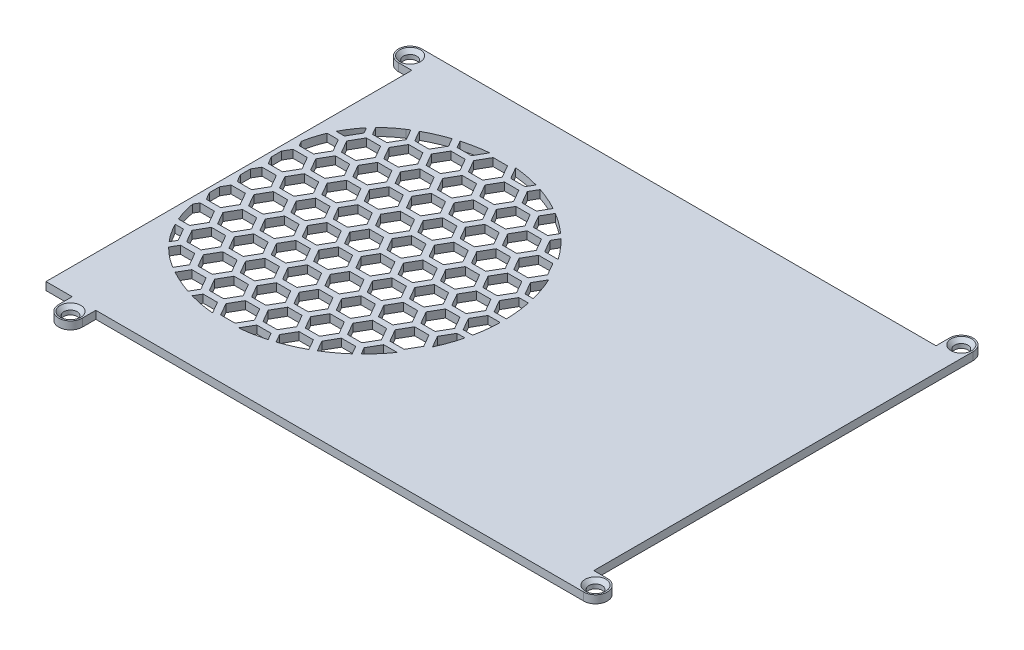
from build123d import *

# Parameters (mm, degrees)
BOSS_EXTRUDE1_DEPTH            = 2.54
CUT_EXTRUDE1_REACH             = 122.398
FILL_START                     = -2.54
FILL_PATTERN1_DEPTH            = 2.54
SKETCH8_W                      = 169.280324126
SKETCH8_H                      = 125.372999712
BOSS_EXTRUDE2_DEPTH            = 2.54
F_6_CLEARANCE_HOLE1_AT_2_COUNT = 2
F_6_CLEARANCE_HOLE1_AT_2_PITCH = 170.02707605
F_6_CLEARANCE_HOLE1_AT_3_COUNT = 2
F_6_CLEARANCE_HOLE1_AT_3_PITCH = 203.837142656
F_6_CLEARANCE_HOLE1_AT_4_COUNT = 2
F_6_CLEARANCE_HOLE1_AT_4_PITCH = 126.560334129


# Read off the part's stored shape, not the designer's step: Fill Pattern1
with BuildPart() as part:
    # Sketch1 → Boss-Extrude1 (new body)
    with BuildSketch(Plane(origin=(0, 0, 0), x_dir=(1, 0, 0), z_dir=(0, 1, 0))):
        with BuildLine():
            Line((-93.360827885, 62.872999984), (72.659829659, 62.872999984))
            Line((72.659829659, 62.872999984), (72.659829659, 67.233333402))
            ThreePointArc((72.659829659, 67.233333402), (76.469829659, 71.043333402), (80.279829659, 67.233333402))
            Line((80.279829659, 67.233333402), (80.279829659, -55.252999984))
            Line((80.279829659, -55.252999984), (84.640163077, -55.252999984))
            ThreePointArc((84.640163077, -55.252999984), (88.450163077, -59.062999984), (84.640163077, -62.872999984))
            Line((84.640163077, -62.872999984), (-72.913826361, -62.872999984))
            Line((-72.913826361, -62.872999984), (-72.913826361, -67.233333402))
            ThreePointArc((-72.913826361, -67.233333402), (-76.723826361, -71.043333402), (-80.533826361, -67.233333402))
            Line((-80.533826361, -67.233333402), (-80.533826361, -62.872999984))
            Line((-80.533826361, -62.872999984), (-89.000494467, -62.872999984))
            Line((-89.000494467, -62.872999984), (-89.000494467, 55.252999984))
            Line((-89.000494467, 55.252999984), (-93.360827885, 55.252999984))
            ThreePointArc((-93.360827885, 55.252999984), (-97.170827885, 59.062999984), (-93.360827885, 62.872999984))
        make_face()
    extrude(amount=-BOSS_EXTRUDE1_DEPTH)

    # Sketch7 → Cut-Extrude1 (cut, up to next)
    with BuildSketch(Plane(origin=(0, 0, 0), x_dir=(1, 0, 0), z_dir=(0, 1, 0)), mode=Mode.PRIVATE) as cut_extrude1_sk1:
        Polygon((-44.541691973, 0), (-46.85109305, 4.000000001), (-51.469895205, 4.000000001), (-53.779296282, 0), (-51.469895205, -4.000000001), (-46.85109305, -4.000000001), align=None)
    cut_extrude1_tool1 = extrude(cut_extrude1_sk1.sketch, amount=-CUT_EXTRUDE1_REACH, mode=Mode.PRIVATE) & part.part
    add(cut_extrude1_tool1.solids().sort_by_distance((-49.160494, 0, 0))[0], mode=Mode.SUBTRACT)

    # Fill Pattern1 outline → Fill Pattern1 (cut)
    with BuildSketch(Plane(origin=(0, 0, 0), x_dir=(1, 0, 0), z_dir=(0, 1, 0)).offset(FILL_START)):
        Polygon((-34.149387015, 26.000000197), (-29.53058486, 26.000000197), (-27.221183783, 30.000000198), (-29.53058486, 34.000000199), (-34.149387015, 34.000000199), (-36.458788092, 30.000000198), align=None)
        Polygon((-60.1301493, -19.0000001), (-55.511347145, -19.0000001), (-53.201946068, -15.000000099), (-55.511347145, -11.000000098), (-60.1301493, -11.000000098), (-62.439550377, -15.000000099), align=None)
        Polygon((-68.790403395, -34.000000199), (-64.17160124, -34.000000199), (-61.862200163, -30.000000198), (-64.17160124, -26.000000197), (-68.790403395, -26.000000197), (-71.099804472, -30.000000198), align=None)
        Polygon((-42.80964111, 11.000000098), (-38.190838955, 11.000000098), (-35.881437878, 15.000000099), (-38.190838955, 19.0000001), (-42.80964111, 19.0000001), (-45.119042187, 15.000000099), align=None)
        Polygon((-88.420312662, 0), (-86.110911585, -4.000000001), (-81.49210943, -4.000000001), (-79.182708353, 0), (-81.49210943, 4.000000001), (-86.110911585, 4.000000001), align=None)
        Polygon((-71.099804472, 0), (-68.790403395, -4.000000001), (-64.17160124, -4.000000001), (-61.862200163, 0), (-64.17160124, 4.000000001), (-68.790403395, 4.000000001), align=None)
        Polygon((-19.138279902, 0), (-16.828878825, -4.000000001), (-12.21007667, -4.000000001), (-9.900675593, 0), (-12.21007667, 4.000000001), (-16.828878825, 4.000000001), align=None)
        Polygon((-36.458788092, 0), (-34.149387015, -4.000000001), (-29.53058486, -4.000000001), (-27.221183783, 0), (-29.53058486, 4.000000001), (-34.149387015, 4.000000001), align=None)
        Polygon((-34.149387015, -26.000000197), (-36.458788092, -30.000000198), (-34.149387015, -34.000000199), (-29.53058486, -34.000000199), (-27.221183783, -30.000000198), (-29.53058486, -26.000000197), align=None)
        Polygon((-42.80964111, -11.000000098), (-45.119042187, -15.000000099), (-42.80964111, -19.0000001), (-38.190838955, -19.0000001), (-35.881437878, -15.000000099), (-38.190838955, -11.000000098), align=None)
        Polygon((-68.790403395, 34.000000199), (-71.099804472, 30.000000198), (-68.790403395, 26.000000197), (-64.17160124, 26.000000197), (-61.862200163, 30.000000198), (-64.17160124, 34.000000199), align=None)
        Polygon((-60.1301493, 19.0000001), (-62.439550377, 15.000000099), (-60.1301493, 11.000000098), (-55.511347145, 11.000000098), (-53.201946068, 15.000000099), (-55.511347145, 19.0000001), align=None)
        Polygon((-60.1301493, -49.000000298), (-55.511347145, -49.000000298), (-53.201946068, -45.000000297), (-55.511347145, -41.000000296), (-60.1301493, -41.000000296), (-62.439550377, -45.000000297), align=None)
        Polygon((-16.828878825, 26.000000197), (-12.21007667, 26.000000197), (-9.900675593, 30.000000198), (-12.21007667, 34.000000199), (-16.828878825, 34.000000199), (-19.138279902, 30.000000198), align=None)
        Polygon((-51.469895205, -34.000000199), (-46.85109305, -34.000000199), (-44.541691973, -30.000000198), (-46.85109305, -26.000000197), (-51.469895205, -26.000000197), (-53.779296282, -30.000000198), align=None)
        Polygon((-25.48913292, 11.000000098), (-20.870330765, 11.000000098), (-18.560929688, 15.000000099), (-20.870330765, 19.0000001), (-25.48913292, 19.0000001), (-27.798533997, 15.000000099), align=None)
        Polygon((-45.119042187, -45.000000297), (-42.80964111, -49.000000298), (-38.190838955, -49.000000298), (-35.881437878, -45.000000297), (-38.190838955, -41.000000296), (-42.80964111, -41.000000296), align=None)
        Polygon((-77.45065749, -11.000000098), (-79.760058567, -15.000000099), (-77.45065749, -19.0000001), (-72.831855335, -19.0000001), (-70.522454258, -15.000000099), (-72.831855335, -11.000000098), align=None)
        Polygon((-16.828878825, 16.000000131), (-12.21007667, 16.000000131), (-9.900675593, 20.000000132), (-12.21007667, 24.000000133), (-16.828878825, 24.000000133), (-19.138279902, 20.000000132), align=None)
        Polygon((-42.80964111, -29.000000166), (-38.190838955, -29.000000166), (-35.881437878, -25.000000165), (-38.190838955, -21.000000164), (-42.80964111, -21.000000164), (-45.119042187, -25.000000165), align=None)
        Polygon((-51.469895205, -44.000000265), (-46.85109305, -44.000000265), (-44.541691973, -40.000000264), (-46.85109305, -36.000000263), (-51.469895205, -36.000000263), (-53.779296282, -40.000000264), align=None)
        Polygon((-25.48913292, 1.000000032), (-20.870330765, 1.000000032), (-18.560929688, 5.000000033), (-20.870330765, 9.000000034), (-25.48913292, 9.000000034), (-27.798533997, 5.000000033), align=None)
        Polygon((-34.149387015, -14.000000067), (-29.53058486, -14.000000067), (-27.221183783, -10.000000066), (-29.53058486, -6.000000065), (-34.149387015, -6.000000065), (-36.458788092, -10.000000066), align=None)
        Polygon((-71.099804472, 20.000000132), (-68.790403395, 16.000000131), (-64.17160124, 16.000000131), (-61.862200163, 20.000000132), (-64.17160124, 24.000000133), (-68.790403395, 24.000000133), align=None)
        Polygon((-53.779296282, 20.000000132), (-51.469895205, 16.000000131), (-46.85109305, 16.000000131), (-44.541691973, 20.000000132), (-46.85109305, 24.000000133), (-51.469895205, 24.000000133), align=None)
        Polygon((-36.458788092, 20.000000132), (-34.149387015, 16.000000131), (-29.53058486, 16.000000131), (-27.221183783, 20.000000132), (-29.53058486, 24.000000133), (-34.149387015, 24.000000133), align=None)
        Polygon((-88.420312662, 20.000000132), (-86.110911585, 16.000000131), (-81.49210943, 16.000000131), (-79.182708353, 20.000000132), (-81.49210943, 24.000000133), (-86.110911585, 24.000000133), align=None)
        Polygon((-25.48913292, 39.000000232), (-27.798533997, 35.000000231), (-25.48913292, 31.00000023), (-20.870330765, 31.00000023), (-18.560929688, 35.000000231), (-20.870330765, 39.000000232), align=None)
        Polygon((-8.16862473, 9.000000034), (-10.478025807, 5.000000033), (-8.16862473, 1.000000032), (-3.549822575, 1.000000032), (-1.240421498, 5.000000033), (-3.549822575, 9.000000034), align=None)
        Polygon((-8.16862473, 11.000000098), (-3.549822575, 11.000000098), (-1.240421498, 15.000000099), (-3.549822575, 19.0000001), (-8.16862473, 19.0000001), (-10.478025807, 15.000000099), align=None)
        Polygon((-25.48913292, -19.0000001), (-20.870330765, -19.0000001), (-18.560929688, -15.000000099), (-20.870330765, -11.000000098), (-25.48913292, -11.000000098), (-27.798533997, -15.000000099), align=None)
        Polygon((-79.760058567, 15.000000099), (-77.45065749, 11.000000098), (-72.831855335, 11.000000098), (-70.522454258, 15.000000099), (-72.831855335, 19.0000001), (-77.45065749, 19.0000001), align=None)
        Polygon((-53.779296282, 30.000000198), (-51.469895205, 26.000000197), (-46.85109305, 26.000000197), (-44.541691973, 30.000000198), (-46.85109305, 34.000000199), (-51.469895205, 34.000000199), align=None)
        Polygon((-88.420312662, 30.000000198), (-86.110911585, 26.000000197), (-81.49210943, 26.000000197), (-79.182708353, 30.000000198), (-81.49210943, 34.000000199), (-86.110911585, 34.000000199), align=None)
        Polygon((-42.80964111, 49.000000298), (-45.119042187, 45.000000297), (-42.80964111, 41.000000296), (-38.190838955, 41.000000296), (-35.881437878, 45.000000297), (-38.190838955, 49.000000298), align=None)
        Polygon((-8.16862473, -11.000000098), (-10.478025807, -15.000000099), (-8.16862473, -19.0000001), (-3.549822575, -19.0000001), (-1.240421498, -15.000000099), (-3.549822575, -11.000000098), align=None)
        Polygon((-25.48913292, 21.000000164), (-20.870330765, 21.000000164), (-18.560929688, 25.000000165), (-20.870330765, 29.000000166), (-25.48913292, 29.000000166), (-27.798533997, 25.000000165), align=None)
        Polygon((-51.469895205, -24.000000133), (-46.85109305, -24.000000133), (-44.541691973, -20.000000132), (-46.85109305, -16.000000131), (-51.469895205, -16.000000131), (-53.779296282, -20.000000132), align=None)
        Polygon((-60.1301493, -39.000000232), (-55.511347145, -39.000000232), (-53.201946068, -35.000000231), (-55.511347145, -31.00000023), (-60.1301493, -31.00000023), (-62.439550377, -35.000000231), align=None)
        Polygon((-34.149387015, 6.000000065), (-29.53058486, 6.000000065), (-27.221183783, 10.000000066), (-29.53058486, 14.000000067), (-34.149387015, 14.000000067), (-36.458788092, 10.000000066), align=None)
        Polygon((-42.80964111, -9.000000034), (-38.190838955, -9.000000034), (-35.881437878, -5.000000033), (-38.190838955, -1.000000032), (-42.80964111, -1.000000032), (-45.119042187, -5.000000033), align=None)
        Polygon((-45.119042187, 25.000000165), (-42.80964111, 21.000000164), (-38.190838955, 21.000000164), (-35.881437878, 25.000000165), (-38.190838955, 29.000000166), (-42.80964111, 29.000000166), align=None)
        Polygon((-79.760058567, 25.000000165), (-77.45065749, 21.000000164), (-72.831855335, 21.000000164), (-70.522454258, 25.000000165), (-72.831855335, 29.000000166), (-77.45065749, 29.000000166), align=None)
        Polygon((-62.439550377, 25.000000165), (-60.1301493, 21.000000164), (-55.511347145, 21.000000164), (-53.201946068, 25.000000165), (-55.511347145, 29.000000166), (-60.1301493, 29.000000166), align=None)
        Polygon((-34.149387015, 44.000000265), (-36.458788092, 40.000000264), (-34.149387015, 36.000000263), (-29.53058486, 36.000000263), (-27.221183783, 40.000000264), (-29.53058486, 44.000000265), align=None)
        Polygon((-8.16862473, -1.000000032), (-10.478025807, -5.000000033), (-8.16862473, -9.000000034), (-3.549822575, -9.000000034), (-1.240421498, -5.000000033), (-3.549822575, -1.000000032), align=None)
        Polygon((-16.828878825, 14.000000067), (-19.138279902, 10.000000066), (-16.828878825, 6.000000065), (-12.21007667, 6.000000065), (-9.900675593, 10.000000066), (-12.21007667, 14.000000067), align=None)
        Polygon((-86.110911585, -34.000000199), (-81.49210943, -34.000000199), (-79.182708353, -30.000000198), (-81.49210943, -26.000000197), (-86.110911585, -26.000000197), (-88.420312662, -30.000000198), align=None)
        Polygon((-60.1301493, 49.000000298), (-62.439550377, 45.000000297), (-60.1301493, 41.000000296), (-55.511347145, 41.000000296), (-53.201946068, 45.000000297), (-55.511347145, 49.000000298), align=None)
        Polygon((-16.828878825, -26.000000197), (-19.138279902, -30.000000198), (-16.828878825, -34.000000199), (-12.21007667, -34.000000199), (-9.900675593, -30.000000198), (-12.21007667, -26.000000197), align=None)
        Polygon((-60.1301493, -9.000000034), (-55.511347145, -9.000000034), (-53.201946068, -5.000000033), (-55.511347145, -1.000000032), (-60.1301493, -1.000000032), (-62.439550377, -5.000000033), align=None)
        Polygon((-77.45065749, -39.000000232), (-72.831855335, -39.000000232), (-70.522454258, -35.000000231), (-72.831855335, -31.00000023), (-77.45065749, -31.00000023), (-79.760058567, -35.000000231), align=None)
        Polygon((-68.790403395, -24.000000133), (-64.17160124, -24.000000133), (-61.862200163, -20.000000132), (-64.17160124, -16.000000131), (-68.790403395, -16.000000131), (-71.099804472, -20.000000132), align=None)
        Polygon((-51.469895205, 6.000000065), (-46.85109305, 6.000000065), (-44.541691973, 10.000000066), (-46.85109305, 14.000000067), (-51.469895205, 14.000000067), (-53.779296282, 10.000000066), align=None)
        Polygon((-51.469895205, 44.000000265), (-53.779296282, 40.000000264), (-51.469895205, 36.000000263), (-46.85109305, 36.000000263), (-44.541691973, 40.000000264), (-46.85109305, 44.000000265), align=None)
        Polygon((-16.828878825, -16.000000131), (-19.138279902, -20.000000132), (-16.828878825, -24.000000133), (-12.21007667, -24.000000133), (-9.900675593, -20.000000132), (-12.21007667, -16.000000131), align=None)
        Polygon((-25.48913292, -1.000000032), (-27.798533997, -5.000000033), (-25.48913292, -9.000000034), (-20.870330765, -9.000000034), (-18.560929688, -5.000000033), (-20.870330765, -1.000000032), align=None)
        Polygon((-68.790403395, 36.000000263), (-64.17160124, 36.000000263), (-61.862200163, 40.000000264), (-64.17160124, 44.000000265), (-68.790403395, 44.000000265), (-71.099804472, 40.000000264), align=None)
        Polygon((-86.110911585, 6.000000065), (-81.49210943, 6.000000065), (-79.182708353, 10.000000066), (-81.49210943, 14.000000067), (-86.110911585, 14.000000067), (-88.420312662, 10.000000066), align=None)
        Polygon((-25.48913292, -31.00000023), (-27.798533997, -35.000000231), (-25.48913292, -39.000000232), (-20.870330765, -39.000000232), (-18.560929688, -35.000000231), (-20.870330765, -31.00000023), align=None)
        Polygon((-34.149387015, -16.000000131), (-36.458788092, -20.000000132), (-34.149387015, -24.000000133), (-29.53058486, -24.000000133), (-27.221183783, -20.000000132), (-29.53058486, -16.000000131), align=None)
        Polygon((-60.1301493, 31.00000023), (-55.511347145, 31.00000023), (-53.201946068, 35.000000231), (-55.511347145, 39.000000232), (-60.1301493, 39.000000232), (-62.439550377, 35.000000231), align=None)
        Polygon((-77.45065749, 1.000000032), (-72.831855335, 1.000000032), (-70.522454258, 5.000000033), (-72.831855335, 9.000000034), (-77.45065749, 9.000000034), (-79.760058567, 5.000000033), align=None)
        Polygon((-86.110911585, -14.000000067), (-81.49210943, -14.000000067), (-79.182708353, -10.000000066), (-81.49210943, -6.000000065), (-86.110911585, -6.000000065), (-88.420312662, -10.000000066), align=None)
        Polygon((-45.119042187, 35.000000231), (-42.80964111, 31.00000023), (-38.190838955, 31.00000023), (-35.881437878, 35.000000231), (-38.190838955, 39.000000232), (-42.80964111, 39.000000232), align=None)
        Polygon((-79.760058567, 35.000000231), (-77.45065749, 31.00000023), (-72.831855335, 31.00000023), (-70.522454258, 35.000000231), (-72.831855335, 39.000000232), (-77.45065749, 39.000000232), align=None)
        Polygon((-25.48913292, -21.000000164), (-27.798533997, -25.000000165), (-25.48913292, -29.000000166), (-20.870330765, -29.000000166), (-18.560929688, -25.000000165), (-20.870330765, -21.000000164), align=None)
        Polygon((-42.80964111, 9.000000034), (-45.119042187, 5.000000033), (-42.80964111, 1.000000032), (-38.190838955, 1.000000032), (-35.881437878, 5.000000033), (-38.190838955, 9.000000034), align=None)
        Polygon((-51.469895205, -14.000000067), (-46.85109305, -14.000000067), (-44.541691973, -10.000000066), (-46.85109305, -6.000000065), (-51.469895205, -6.000000065), (-53.779296282, -10.000000066), align=None)
        Polygon((-68.790403395, -44.000000265), (-64.17160124, -44.000000265), (-61.862200163, -40.000000264), (-64.17160124, -36.000000263), (-68.790403395, -36.000000263), (-71.099804472, -40.000000264), align=None)
        Polygon((-60.1301493, -29.000000166), (-55.511347145, -29.000000166), (-53.201946068, -25.000000165), (-55.511347145, -21.000000164), (-60.1301493, -21.000000164), (-62.439550377, -25.000000165), align=None)
        Polygon((-77.45065749, -9.000000034), (-72.831855335, -9.000000034), (-70.522454258, -5.000000033), (-72.831855335, -1.000000032), (-77.45065749, -1.000000032), (-79.760058567, -5.000000033), align=None)
        Polygon((-86.110911585, -24.000000133), (-81.49210943, -24.000000133), (-79.182708353, -20.000000132), (-81.49210943, -16.000000131), (-86.110911585, -16.000000131), (-88.420312662, -20.000000132), align=None)
        Polygon((-68.790403395, 6.000000065), (-64.17160124, 6.000000065), (-61.862200163, 10.000000066), (-64.17160124, 14.000000067), (-68.790403395, 14.000000067), (-71.099804472, 10.000000066), align=None)
        Polygon((-68.790403395, -14.000000067), (-64.17160124, -14.000000067), (-61.862200163, -10.000000066), (-64.17160124, -6.000000065), (-68.790403395, -6.000000065), (-71.099804472, -10.000000066), align=None)
        Polygon((-77.45065749, -29.000000166), (-72.831855335, -29.000000166), (-70.522454258, -25.000000165), (-72.831855335, -21.000000164), (-77.45065749, -21.000000164), (-79.760058567, -25.000000165), align=None)
        Polygon((-60.1301493, 1.000000032), (-55.511347145, 1.000000032), (-53.201946068, 5.000000033), (-55.511347145, 9.000000034), (-60.1301493, 9.000000034), (-62.439550377, 5.000000033), align=None)
        Polygon((-16.828878825, -6.000000065), (-19.138279902, -10.000000066), (-16.828878825, -14.000000067), (-12.21007667, -14.000000067), (-9.900675593, -10.000000066), (-12.21007667, -6.000000065), align=None)
        Polygon((-45.119042187, -35.000000231), (-42.80964111, -39.000000232), (-38.190838955, -39.000000232), (-35.881437878, -35.000000231), (-38.190838955, -31.00000023), (-42.80964111, -31.00000023), align=None)
        Polygon((-34.149387015, -36.000000263), (-36.458788092, -40.000000264), (-34.149387015, -44.000000265), (-29.53058486, -44.000000265), (-27.221183783, -40.000000264), (-29.53058486, -36.000000263), align=None)
    extrude(amount=FILL_PATTERN1_DEPTH, mode=Mode.SUBTRACT)

    # Sketch8 → Boss-Extrude2 (add)
    with BuildSketch(Plane(origin=(0, 0, 0), x_dir=(1, 0, 0), z_dir=(0, 1, 0))):
        with Locations((-4.360332404, -0.186500128)):
            Rectangle(SKETCH8_W, SKETCH8_H)
        with BuildLine():
            Line((-87.476493226, 12.174136607), (-87.476493226, -12.174136607))
            ThreePointArc((-87.476493226, -12.174136607), (-83.753306279, -26.772196589), (-73.493333434, -37.803897885))
            ThreePointArc((-73.493333434, -37.803897885), (-4.202494127, 0), (-73.493333434, 37.803897885))
            ThreePointArc((-73.493333434, 37.803897885), (-83.753306279, 26.772196589), (-87.476493226, 12.174136607))
        make_face(mode=Mode.SUBTRACT)
    extrude(amount=-BOSS_EXTRUDE2_DEPTH)

    # Sketch10 → #6 Clearance Hole1 (revolve, cut)
    with BuildSketch(Plane(origin=(76.469829659, 0, -67.233333402), x_dir=(0, 0, 1), z_dir=(1, 0, 0))):
        Polygon((0, 0), (0, 2.54), (2.15265, 2.54), (2.15265, 1.17475), (3.3274, 0), align=None)
    f_6_clearance_hole1 = revolve(axis=Axis((76.469829659, 6.35, -67.233333402), (0, -1, 0)), mode=Mode.SUBTRACT)

    # #6 Clearance Hole1 at 2: #6 Clearance Hole1 ×2
    with Locations(*[Vector(-0.9988447810184149, 0, 0.04805313134723814) * (i * F_6_CLEARANCE_HOLE1_AT_2_PITCH) for i in range(1, F_6_CLEARANCE_HOLE1_AT_2_COUNT)]):
        add(f_6_clearance_hole1, mode=Mode.SUBTRACT)

    # #6 Clearance Hole1 at 3: #6 Clearance Hole1 ×2
    with Locations(*[Vector(-0.7515492712657978, 0, 0.6596769609891255) * (i * F_6_CLEARANCE_HOLE1_AT_3_PITCH) for i in range(1, F_6_CLEARANCE_HOLE1_AT_3_COUNT)]):
        add(f_6_clearance_hole1, mode=Mode.SUBTRACT)

    # #6 Clearance Hole1 at 4: #6 Clearance Hole1 ×2
    with Locations(*[Vector(0.06455682559794475, 0, 0.9979140325041614) * (i * F_6_CLEARANCE_HOLE1_AT_4_PITCH) for i in range(1, F_6_CLEARANCE_HOLE1_AT_4_COUNT)]):
        add(f_6_clearance_hole1, mode=Mode.SUBTRACT)


solid = part.part
